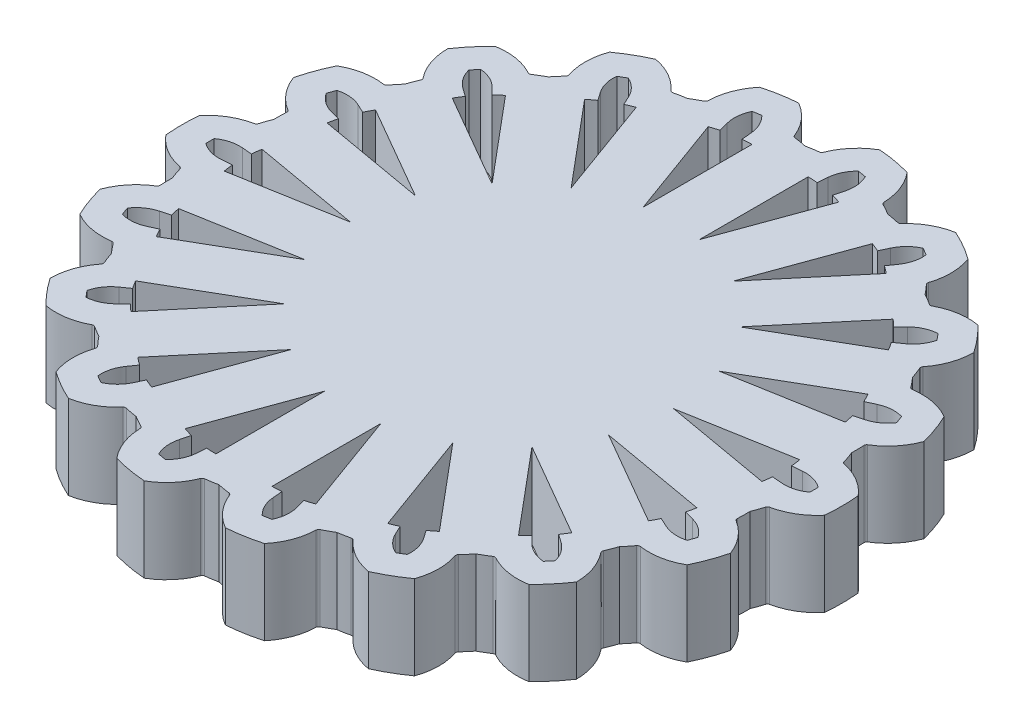
from build123d import *

# Parameters (mm, degrees)
EXTRUDE_THIN1_DEPTH      = 30
FILLET1_R                = 1
CIRPATTERN1_COUNT        = 18
FILLET1_OF_CIRPATTERN1_R = 1


# Read off the part's stored shape, not the designer's step: Extrude-Thin1
with BuildPart() as part:
    # Extrude-Thin1 outline → Extrude-Thin1 (new body)
    with BuildSketch(Plane(origin=(0, 0, 0), x_dir=(1, 0, 0), z_dir=(0, 1, 0))):
        with BuildLine():
            ThreePointArc((46.875643261, -13.404111002), (53.938825897, -10.839188421), (59.698011896, -6.01226876))
            ThreePointArc((59.698011896, -6.01226876), (60, 0), (59.698011896, 6.01226876))
            ThreePointArc((59.698011896, 6.01226876), (53.938825897, 10.839188421), (46.875643261, 13.404111002))
            ThreePointArc((46.875643261, 13.404111002), (46.126721196, 15.789924465), (45.256456933, 18.134200527))
            Line((45.256456933, 18.134200527), (-57.587704831, 0))
            Line((-57.587704831, 0), (45.256456933, -18.134200527))
            ThreePointArc((45.256456933, -18.134200527), (46.126721196, -15.789924465), (46.875643261, -13.404111002))
        make_face()
        with BuildLine():
            ThreePointArc((49.977345704, -1.504963914), (46.248028557, -3.305825336), (42.124092809, -3.685380582))
            Line((42.124092809, -3.685380582), (38.60697484, -3.377672631))
            ThreePointArc((38.60697484, -3.377672631), (38.422897543, -5.058470426), (38.165680078, -6.729639135))
            Line((38.165680078, -6.729639135), (0, 0))
            Line((0, 0), (38.165680078, 6.729639135))
            ThreePointArc((38.165680078, 6.729639135), (38.422897543, 5.058470426), (38.60697484, 3.377672631))
            Line((38.60697484, 3.377672631), (42.124092809, 3.685380582))
            ThreePointArc((42.124092809, 3.685380582), (46.248028557, 3.305825336), (49.977345704, 1.504963914))
            ThreePointArc((49.977345704, 1.504963914), (50, 0), (49.977345704, -1.504963914))
        make_face(mode=Mode.SUBTRACT)
    extrude_thin1 = extrude(amount=EXTRUDE_THIN1_DEPTH)

    # Fillet1
    fillet1_edges = [part.edges().sort_by_distance(p)[0] for p in [
        (46.875643261, 15, 13.404111002),
        (46.875643261, 15, -13.404111002),
    ]]
    fillet(fillet1_edges, radius=FILLET1_R)

    # CirPattern1: Extrude-Thin1 ×18 about axis
    cirpattern1_axis = Axis((-57.587704831, 0, 0), (0, 1, 0))
    for i in range(1, CIRPATTERN1_COUNT):
        add(extrude_thin1.rotate(cirpattern1_axis, i * 360 / CIRPATTERN1_COUNT))

    # Fillet1 of CirPattern1
    fillet1_of_cirpattern1_edges = [part.edges().sort_by_distance(p)[0] for p in [
        (45.16020848, 15, -23.13282509),
        (35.991256548, 15, -48.324313484),
        (31.051858955, 15, -56.879601072),
        (13.819866013, 15, -77.415890568),
        (6.252269858, 15, -83.765857711),
        (-16.964331428, 15, -97.169968713),
        (-26.247362365, 15, -100.548715658),
        (-52.648307239, 15, -105.203914556),
        (-62.527102424, 15, -105.203914556),
        (-88.928047298, 15, -100.548715658),
        (-98.211078235, 15, -97.169968713),
        (-121.427679521, 15, -83.765857711),
        (-128.995275676, 15, -77.415890568),
        (-146.227268618, 15, -56.879601072),
        (-151.16666621, 15, -48.324313484),
        (-160.335618143, 15, -23.13282509),
        (-162.051052924, 15, -13.404111002),
        (-162.051052924, 15, 13.404111002),
        (-160.335618143, 15, 23.13282509),
        (-151.16666621, 15, 48.324313484),
        (-146.227268618, 15, 56.879601072),
        (-128.995275676, 15, 77.415890568),
        (-121.427679521, 15, 83.765857711),
        (-98.211078235, 15, 97.169968713),
        (-88.928047298, 15, 100.548715658),
        (-62.527102424, 15, 105.203914556),
        (-52.648307239, 15, 105.203914556),
        (-26.247362365, 15, 100.548715658),
        (-16.964331428, 15, 97.169968713),
        (6.252269858, 15, 83.765857711),
        (13.819866013, 15, 77.415890568),
        (31.051858955, 15, 56.879601072),
        (35.991256548, 15, 48.324313484),
        (45.16020848, 15, 23.13282509),
    ]]
    fillet(fillet1_of_cirpattern1_edges, radius=FILLET1_OF_CIRPATTERN1_R)


solid = part.part
